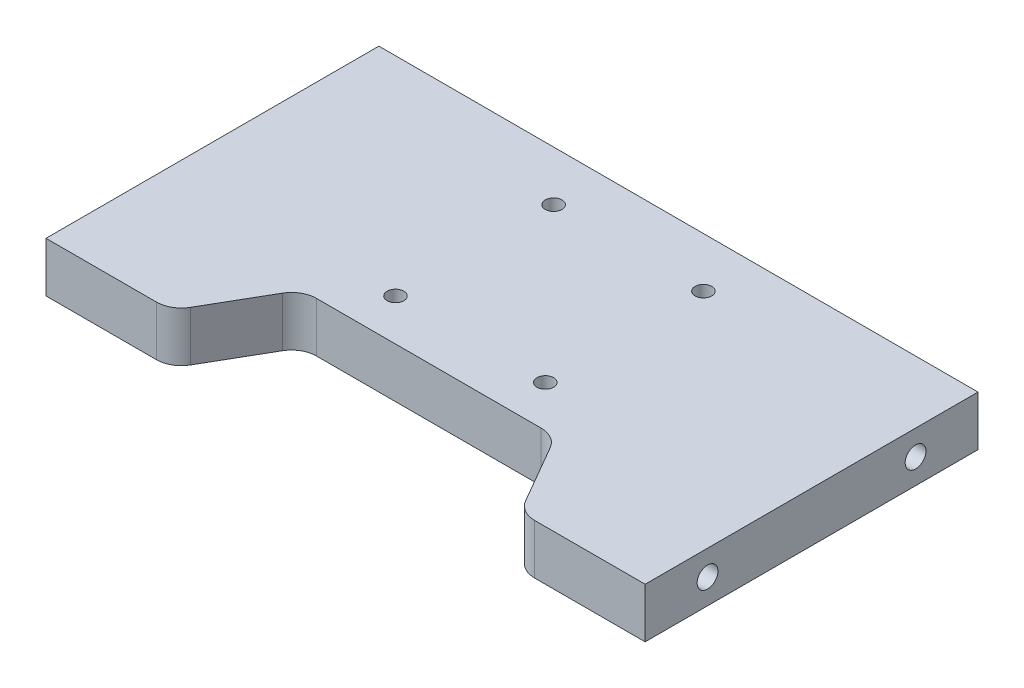
from build123d import *

# Parameters (mm, degrees)
SKETCH1_W                   = 72
SKETCH1_H                   = 40
BOSS_EXTRUDE1_DEPTH         = 6
CUT_EXTRUDE3_REACH          = 84.583
CUT_EXTRUDE4_REACH          = 84.583
SKETCH5_R                   = 1
FILLET1_R                   = 3
TAP_DRILL_FOR_M3_TAP1_D     = 2.5
TAP_DRILL_FOR_M3_TAP1_DEPTH = 10
TAP_DRILL_FOR_M3_TAP1_TIP   = 0.751075774
TAP_DRILL_FOR_M3_TAP2_D     = 2.5
TAP_DRILL_FOR_M3_TAP2_DEPTH = 10
TAP_DRILL_FOR_M3_TAP2_TIP   = 0.751075774


with BuildPart() as part:
    # Sketch1 → Boss-Extrude1 (new body)
    with BuildSketch(Plane(origin=(0, 0, 0), x_dir=(1, 0, 0), z_dir=(0, 1, 0))):
        with Locations((36, 20)):
            Rectangle(SKETCH1_W, SKETCH1_H)
    extrude(amount=BOSS_EXTRUDE1_DEPTH)

    # Sketch4 → Cut-Extrude3 (cut, up to next)
    with BuildSketch(Plane(origin=(0, 6, 0), x_dir=(1, 0, 0), z_dir=(0, 1, 0)), mode=Mode.PRIVATE) as cut_extrude3_sk1:
        Polygon((15, 0), (57, 0), (51.226497308, 10), (20.773502692, 10), align=None)
    cut_extrude3_tool1 = extrude(cut_extrude3_sk1.sketch, amount=-CUT_EXTRUDE3_REACH, mode=Mode.PRIVATE) & part.part
    add(cut_extrude3_tool1.solids().sort_by_distance((36, 6, -4.734379))[0], mode=Mode.SUBTRACT)

    # Sketch5 → Cut-Extrude4 (cut, up to next)
    with BuildSketch(Plane(origin=(0, 6, 0), x_dir=(1, 0, 0), z_dir=(0, 1, 0)), mode=Mode.PRIVATE) as cut_extrude4_sk1:
        with Locations((27, 15)):
            Circle(SKETCH5_R)
    cut_extrude4_tool1 = extrude(cut_extrude4_sk1.sketch, amount=-CUT_EXTRUDE4_REACH, mode=Mode.PRIVATE) & part.part
    # Sketch5 → Cut-Extrude4 (cut, up to next)
    with BuildSketch(Plane(origin=(0, 6, 0), x_dir=(1, 0, 0), z_dir=(0, 1, 0)), mode=Mode.PRIVATE) as cut_extrude4_sk2:
        with Locations((45, 15)):
            Circle(SKETCH5_R)
    cut_extrude4_tool2 = extrude(cut_extrude4_sk2.sketch, amount=-CUT_EXTRUDE4_REACH, mode=Mode.PRIVATE) & part.part
    # Sketch5 → Cut-Extrude4 (cut, up to next)
    with BuildSketch(Plane(origin=(0, 6, 0), x_dir=(1, 0, 0), z_dir=(0, 1, 0)), mode=Mode.PRIVATE) as cut_extrude4_sk3:
        with Locations((45, 34)):
            Circle(SKETCH5_R)
    cut_extrude4_tool3 = extrude(cut_extrude4_sk3.sketch, amount=-CUT_EXTRUDE4_REACH, mode=Mode.PRIVATE) & part.part
    # Sketch5 → Cut-Extrude4 (cut, up to next)
    with BuildSketch(Plane(origin=(0, 6, 0), x_dir=(1, 0, 0), z_dir=(0, 1, 0)), mode=Mode.PRIVATE) as cut_extrude4_sk4:
        with Locations((27, 34)):
            Circle(SKETCH5_R)
    cut_extrude4_tool4 = extrude(cut_extrude4_sk4.sketch, amount=-CUT_EXTRUDE4_REACH, mode=Mode.PRIVATE) & part.part
    add(cut_extrude4_tool1.solids().sort_by_distance((27, 6, -15))[0], mode=Mode.SUBTRACT)
    add(cut_extrude4_tool2.solids().sort_by_distance((45, 6, -15))[0], mode=Mode.SUBTRACT)
    add(cut_extrude4_tool3.solids().sort_by_distance((45, 6, -34))[0], mode=Mode.SUBTRACT)
    add(cut_extrude4_tool4.solids().sort_by_distance((27, 6, -34))[0], mode=Mode.SUBTRACT)

    # Fillet1
    fillet1_edges = [part.edges().sort_by_distance(p)[0] for p in [
        (57, 3, 0),
        (51.226497308, 3, -10),
        (20.773502692, 3, -10),
        (15, 3, 0),
    ]]
    fillet(fillet1_edges, radius=FILLET1_R)

    # Tap Drill for M3 Tap1
    with Locations(Plane.ZY):
        with Locations((-32.5, 3), (-7.5, 3)):
            Hole(TAP_DRILL_FOR_M3_TAP1_D / 2, depth=TAP_DRILL_FOR_M3_TAP1_DEPTH)
            with Locations((0, 0, -(TAP_DRILL_FOR_M3_TAP1_DEPTH + TAP_DRILL_FOR_M3_TAP1_TIP / 2))):  # 118° drill point
                Cone(0, TAP_DRILL_FOR_M3_TAP1_D / 2, TAP_DRILL_FOR_M3_TAP1_TIP, mode=Mode.SUBTRACT)

    # Tap Drill for M3 Tap2
    with Locations(Plane(origin=(72, 0, 0), x_dir=(0, 0, -1), z_dir=(1, 0, 0))):
        with Locations((7.5, 3), (32.5, 3)):
            Hole(TAP_DRILL_FOR_M3_TAP2_D / 2, depth=TAP_DRILL_FOR_M3_TAP2_DEPTH)
            with Locations((0, 0, -(TAP_DRILL_FOR_M3_TAP2_DEPTH + TAP_DRILL_FOR_M3_TAP2_TIP / 2))):  # 118° drill point
                Cone(0, TAP_DRILL_FOR_M3_TAP2_D / 2, TAP_DRILL_FOR_M3_TAP2_TIP, mode=Mode.SUBTRACT)


solid = part.part
